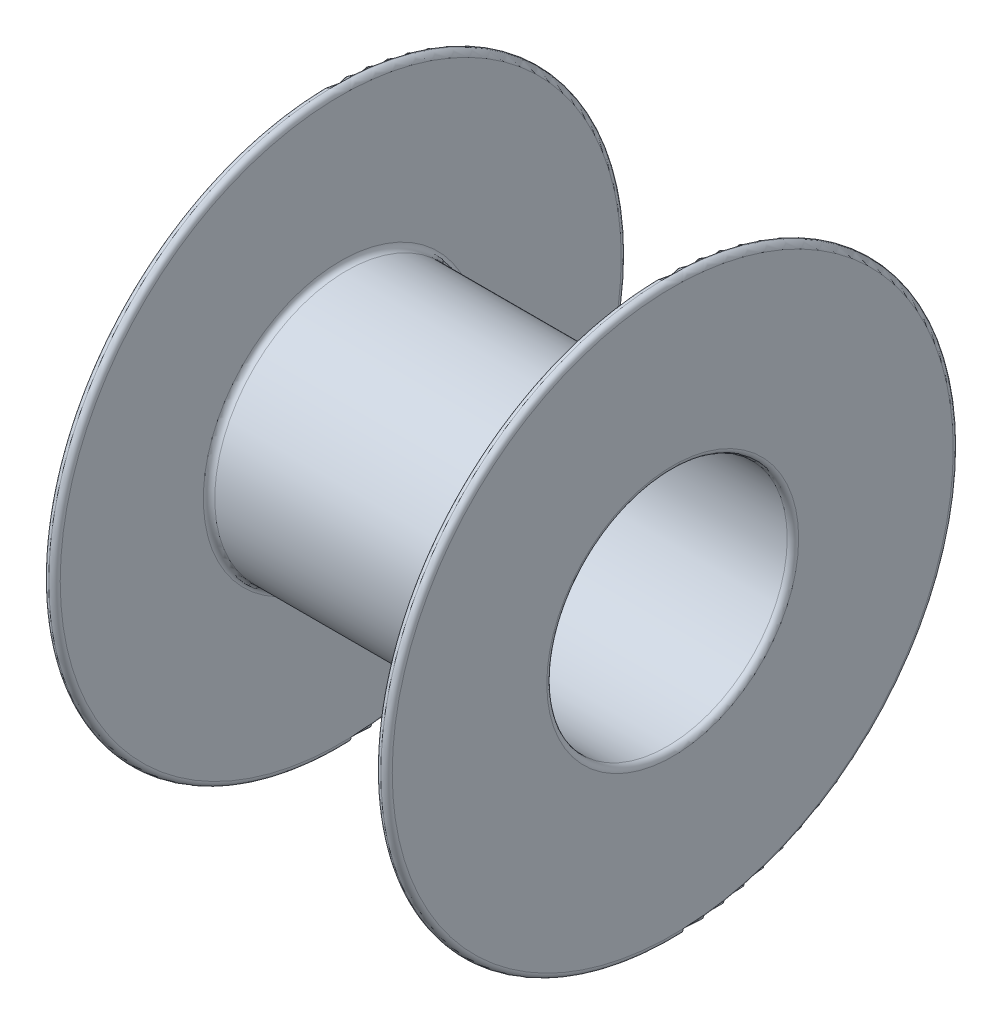
from build123d import *

# Parameters (mm, degrees)
SKETCH1_R           = 11.5
SKETCH1_R_2         = 10.5
BOSS_EXTRUDE1_DEPTH = 15
BOSS_EXTRUDE2_START = 15
SKETCH1_3_R         = 25
SKETCH1_3_R_2       = 11.5
BOSS_EXTRUDE2_DEPTH = 1
BOSS_EXTRUDE3_START = -14
SKETCH1_4_R         = 25
SKETCH1_4_R_2       = 11.5
BOSS_EXTRUDE3_DEPTH = 1
FILLET1_R           = 0.5


with BuildPart() as part:
    # Sketch1 → Boss-Extrude1 (new, symmetric)
    with BuildSketch(Plane(origin=(0, 0, 0), x_dir=(0, 0, -1), z_dir=(1, 0, 0))):
        Circle(SKETCH1_R)
        Circle(SKETCH1_R_2, mode=Mode.SUBTRACT)
    extrude(amount=BOSS_EXTRUDE1_DEPTH, both=True)

    # Sketch1<3> → Boss-Extrude2 (add)
    with BuildSketch(Plane(origin=(0, 0, 0), x_dir=(0, 0, -1), z_dir=(1, 0, 0)).offset(BOSS_EXTRUDE2_START)):
        Circle(SKETCH1_3_R)
        Circle(SKETCH1_3_R_2, mode=Mode.SUBTRACT)
    extrude(amount=-BOSS_EXTRUDE2_DEPTH)

    # Sketch1<4> → Boss-Extrude3 (add)
    with BuildSketch(Plane(origin=(0, 0, 0), x_dir=(0, 0, -1), z_dir=(1, 0, 0)).offset(BOSS_EXTRUDE3_START)):
        Circle(SKETCH1_4_R)
        Circle(SKETCH1_4_R_2, mode=Mode.SUBTRACT)
    extrude(amount=-BOSS_EXTRUDE3_DEPTH)

    # Fillet1
    fillet1_edges = [part.edges().sort_by_distance(p)[0] for p in [
        (-14, 0, 11.5),
        (-15, 0, 25),
        (-14, 0, 25),
        (-15, 0, 10.5),
        (15, 0, 10.5),
        (14, 0, 11.5),
        (14, 0, 25),
        (15, 0, 25),
    ]]
    fillet(fillet1_edges, radius=FILLET1_R - 0.0001)  # a hair under: the kernel refuses the full size


solid = part.part
